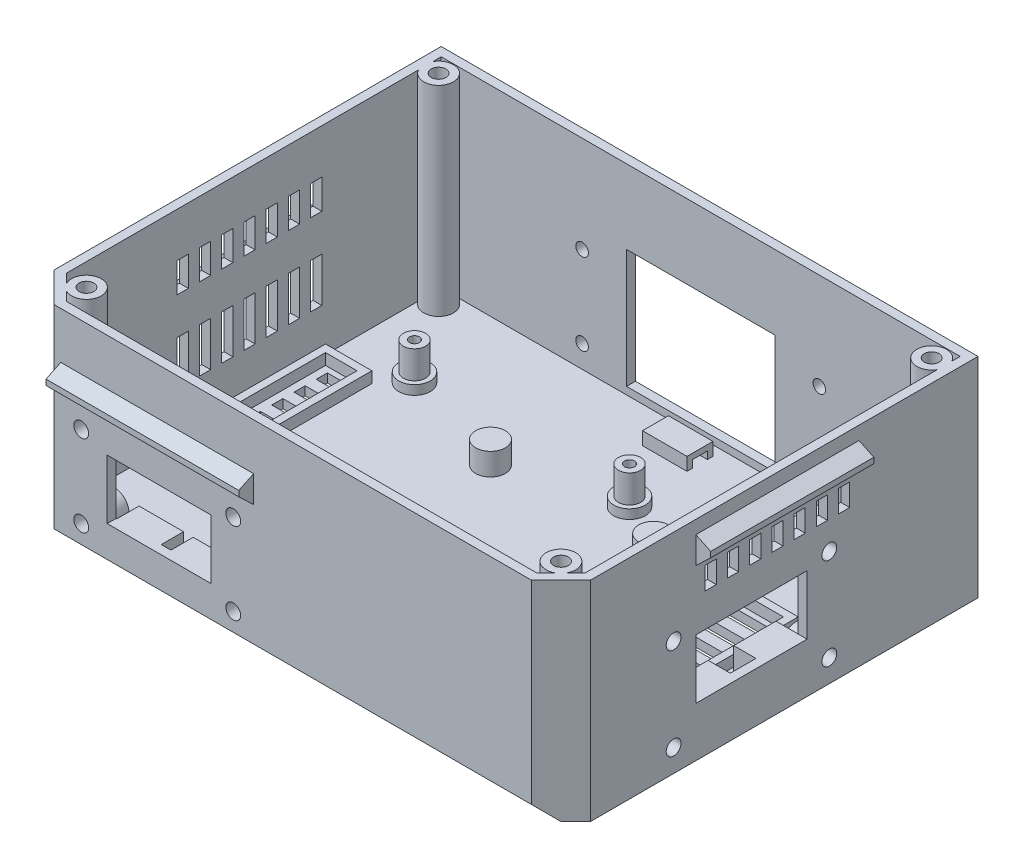
from build123d import *

# Parameters (mm, degrees)
BOX_BLOCK_DEPTH                     = 56.4
REAR_BOTTOM_FACET_DEPTH             = 147.709508894
REAR_BOTTOM_FACET_DEPTH_BACK        = 147.709508894
SHELL_T                             = -2.4
SKETCH3_R                           = 1.7
SKETCH3_W                           = 40
SKETCH3_H                           = 32
CABLE_WINDOW_AND_FLANGE_HOLES_DEPTH = 3.4
SKETCH4_R                           = 3
PI_STANDOFFS_DEPTH                  = 10.5
SKETCH5_R                           = 4.25
PI_STANDOFF_BASES_DEPTH             = 3
SKETCH6_R                           = 1.35
PI_SCREW_HOLES_DEPTH                = 13.4
SKETCH7_R                           = 2.75
PI_COUNTERBORES_DEPTH               = 2.7
SKETCH8_R                           = 4
LID_BOSS_1_DEPTH                    = 54.5
SKETCH9_R                           = 4
LID_BOSS_2_DEPTH                    = 54.5
SKETCH10_R                          = 4
LID_BOSS_3_DEPTH                    = 54.5
SKETCH11_R                          = 4
LID_BOSS_4_DEPTH                    = 54.5
SKETCH12_R                          = 2
LID_INSERT_HOLES_DEPTH              = 6.5
SKETCH13_W                          = 20
SKETCH13_H                          = 40
SKETCH13_W_2                        = 16
SKETCH13_H_2                        = 36
INTAKE_UPSTAND_DEPTH                = 3.5
SKETCH14_W                          = 12
SKETCH14_H                          = 3
INTAKE_SLOTS_DEPTH                  = 3.9
SKETCH15_W                          = 12.5
SKETCH15_H                          = 40
SKETCH15_W_2                        = 8.5
SKETCH15_H_2                        = 36
FLOOR_EXHAUST_UPSTAND_DEPTH         = 3.5
SKETCH16_W                          = 4.5
SKETCH16_H                          = 3
FLOOR_EXHAUST_SLOTS_DEPTH           = 3.9
SKETCH17_W                          = 3
SKETCH17_H                          = 12
EXHAUST_VENTS_DEPTH                 = 3.4
EXHAUST_DRIP_LEDGE_DEPTH            = 44
SKETCH19_W                          = 3
SKETCH19_H                          = 8
UPPER_VENTS_L_DEPTH                 = 3.4
UPPER_DRIP_LEDGE_L_DEPTH            = 44
SKETCH21_W                          = 3
SKETCH21_H                          = 6
UPPER_VENTS_R_DEPTH                 = 3.4
UPPER_DRIP_LEDGE_R_DEPTH            = 44
SKETCH23_W                          = 28
SKETCH23_H                          = 16
REAR_PORT_OPENING_DEPTH             = 3.4
SKETCH24_R                          = 4
REAR_PORT_BOSSES_DEPTH              = 6.6
SKETCH25_W                          = 8
SKETCH25_H                          = 7
REAR_PORT_BOSS_ROOTS_DEPTH          = 6.6
SKETCH26_R                          = 2
REAR_PORT_INSERT_HOLES_DEPTH        = 7
REAR_PORT_DRIP_LEDGE_DEPTH          = 52
SKETCH28_W                          = 12
SKETCH28_H                          = 6.1
REAR_TIE_BLOCK_USBC_DEPTH           = 10.5
SKETCH29_W                          = 3
SKETCH29_H                          = 2
REAR_TIE_TUNNEL_USBC_DEPTH          = 14
SKETCH30_W                          = 12
SKETCH30_H                          = 6.1
REAR_TIE_BLOCK_HDMI_DEPTH           = 10.5
SKETCH31_W                          = 3
SKETCH31_H                          = 2
REAR_TIE_TUNNEL_HDMI_DEPTH          = 14
SKETCH32_W                          = 30
SKETCH32_H                          = 16
SIDE_PORT_OPENING_DEPTH             = 3.4
SKETCH33_R                          = 4
SIDE_PORT_BOSSES_DEPTH              = 6.6
SKETCH34_R                          = 2
SIDE_PORT_INSERT_HOLES_DEPTH        = 7
SKETCH35_W                          = 6.1
SKETCH35_H                          = 11.7
SIDE_TIE_BLOCK_ETH_DEPTH            = 11.5
SKETCH36_W                          = 3
SKETCH36_H                          = 2
SIDE_TIE_TUNNEL_ETH_DEPTH           = 14
SKETCH37_W                          = 6.1
SKETCH37_H                          = 11.4
SIDE_TIE_BLOCK_USBA_DEPTH           = 11.5
SKETCH38_W                          = 3
SKETCH38_H                          = 2
SIDE_TIE_TUNNEL_USBA_DEPTH          = 14
SKETCH39_W                          = 12
SKETCH39_H                          = 7
BUNDLE_TIE_ANCHOR_DEPTH             = 4
SKETCH40_W                          = 4
SKETCH40_H                          = 2
BUNDLE_TIE_SLOT_DEPTH               = 14
SKETCH41_R                          = 4
RAIL_PLATE_BOSSES_DEPTH             = 6.5
SKETCH42_R                          = 2
RAIL_INSERT_HOLES_DEPTH             = 6.5


with BuildPart() as part:
    # Sketch1 → Box Block (new body)
    with BuildSketch(Plane(origin=(0, -28.4, 0), x_dir=(1, 0, 0), z_dir=(0, 1, 0))):
        Polygon((-64.4, -124.4), (64.4, -124.4), (72.4, -116.4), (72.4, -11.9), (-72.4, -11.9), (-72.4, -116.4), align=None)
    extrude(amount=BOX_BLOCK_DEPTH)

    # Sketch2 → Rear Bottom Facet (cut, two sides: drawn at the far end of the back side and taken through both)
    with BuildSketch(Plane(origin=(0, 0, 0), x_dir=(0, 0, -1), z_dir=(1, 0, 0)).offset(-REAR_BOTTOM_FACET_DEPTH_BACK)):
        Polygon((-125.4, -23.4), (-119.4, -29.4), (-125.4, -29.4), align=None)
    extrude(amount=REAR_BOTTOM_FACET_DEPTH + REAR_BOTTOM_FACET_DEPTH_BACK, mode=Mode.SUBTRACT)

    # Shell
    shell_openings = [part.faces().sort_by_distance(p)[0] for p in [
        (0, 28, 67.938651958),
    ]]
    offset(amount=SHELL_T, openings=shell_openings, kind=Kind.INTERSECTION)

    # Sketch3 → Cable Window and Flange Holes (cut)
    with BuildSketch(Plane.XY.offset(11.4)):
        with Locations((-32, 2)):
            Circle(SKETCH3_R)
        with Locations((32, 2)):
            Circle(SKETCH3_R)
        with Locations((-32, -20)):
            Circle(SKETCH3_R)
        with Locations((32, -20)):
            Circle(SKETCH3_R)
        with Locations((0, -8)):
            Rectangle(SKETCH3_W, SKETCH3_H)
    extrude(amount=CABLE_WINDOW_AND_FLANGE_HOLES_DEPTH, mode=Mode.SUBTRACT)

    # Sketch4 → Pi Standoffs (add)
    with BuildSketch(Plane(origin=(0, -26.5, 0), x_dir=(1, 0, 0), z_dir=(0, 1, 0))):
        with Locations((-51.5, -89)):
            Circle(SKETCH4_R)
        with Locations((6.5, -89)):
            Circle(SKETCH4_R)
        with Locations((-51.5, -40)):
            Circle(SKETCH4_R)
        with Locations((6.5, -40)):
            Circle(SKETCH4_R)
    extrude(amount=PI_STANDOFFS_DEPTH)

    # Sketch5 → Pi Standoff Bases (add)
    with BuildSketch(Plane(origin=(0, -26.5, 0), x_dir=(1, 0, 0), z_dir=(0, 1, 0))):
        with Locations((-51.5, -89)):
            Circle(SKETCH5_R)
        with Locations((6.5, -89)):
            Circle(SKETCH5_R)
        with Locations((-51.5, -40)):
            Circle(SKETCH5_R)
        with Locations((6.5, -40)):
            Circle(SKETCH5_R)
    extrude(amount=PI_STANDOFF_BASES_DEPTH)

    # Sketch6 → Pi Screw Holes (cut)
    with BuildSketch(Plane(origin=(0, -28.9, 0), x_dir=(1, 0, 0), z_dir=(0, 1, 0))):
        with Locations((-51.5, -89)):
            Circle(SKETCH6_R)
        with Locations((6.5, -89)):
            Circle(SKETCH6_R)
        with Locations((-51.5, -40)):
            Circle(SKETCH6_R)
        with Locations((6.5, -40)):
            Circle(SKETCH6_R)
    extrude(amount=PI_SCREW_HOLES_DEPTH, mode=Mode.SUBTRACT)

    # Sketch7 → Pi Counterbores (cut)
    with BuildSketch(Plane(origin=(0, -28.9, 0), x_dir=(1, 0, 0), z_dir=(0, 1, 0))):
        with Locations((-51.5, -89)):
            Circle(SKETCH7_R)
        with Locations((6.5, -89)):
            Circle(SKETCH7_R)
        with Locations((-51.5, -40)):
            Circle(SKETCH7_R)
        with Locations((6.5, -40)):
            Circle(SKETCH7_R)
    extrude(amount=PI_COUNTERBORES_DEPTH, mode=Mode.SUBTRACT)

    # Sketch8 → Lid Boss 1 (add)
    with BuildSketch(Plane(origin=(0, -26.5, 0), x_dir=(1, 0, 0), z_dir=(0, 1, 0))):
        with Locations((-66.5, -18.5)):
            Circle(SKETCH8_R)
    extrude(amount=LID_BOSS_1_DEPTH)

    # Sketch9 → Lid Boss 2 (add)
    with BuildSketch(Plane(origin=(0, -26.5, 0), x_dir=(1, 0, 0), z_dir=(0, 1, 0))):
        with Locations((66.5, -18.5)):
            Circle(SKETCH9_R)
    extrude(amount=LID_BOSS_2_DEPTH)

    # Sketch10 → Lid Boss 3 (add)
    with BuildSketch(Plane(origin=(0, -26.5, 0), x_dir=(1, 0, 0), z_dir=(0, 1, 0))):
        with Locations((-64, -116)):
            Circle(SKETCH10_R)
    extrude(amount=LID_BOSS_3_DEPTH)

    # Sketch11 → Lid Boss 4 (add)
    with BuildSketch(Plane(origin=(0, -26.5, 0), x_dir=(1, 0, 0), z_dir=(0, 1, 0))):
        with Locations((64, -116)):
            Circle(SKETCH11_R)
    extrude(amount=LID_BOSS_4_DEPTH)

    # Sketch12 → Lid Insert Holes (cut)
    with BuildSketch(Plane(origin=(0, 22, 0), x_dir=(1, 0, 0), z_dir=(0, 1, 0))):
        with Locations((-66.5, -18.5)):
            Circle(SKETCH12_R)
        with Locations((66.5, -18.5)):
            Circle(SKETCH12_R)
        with Locations((-64, -116)):
            Circle(SKETCH12_R)
        with Locations((64, -116)):
            Circle(SKETCH12_R)
    extrude(amount=LID_INSERT_HOLES_DEPTH, mode=Mode.SUBTRACT)

    # Sketch13 → Intake Upstand (add)
    with BuildSketch(Plane(origin=(0, -26.5, 0), x_dir=(1, 0, 0), z_dir=(0, 1, 0))):
        with Locations((48, -66)):
            Rectangle(SKETCH13_W, SKETCH13_H)
        with Locations((48, -66)):
            Rectangle(SKETCH13_W_2, SKETCH13_H_2, mode=Mode.SUBTRACT)
    extrude(amount=INTAKE_UPSTAND_DEPTH)

    # Sketch14 → Intake Slots (cut)
    with BuildSketch(Plane(origin=(0, -29.4, 0), x_dir=(1, 0, 0), z_dir=(0, 1, 0))):
        with Locations((48, -81)):
            Rectangle(SKETCH14_W, SKETCH14_H)
        with Locations((48, -75)):
            Rectangle(SKETCH14_W, SKETCH14_H)
        with Locations((48, -69)):
            Rectangle(SKETCH14_W, SKETCH14_H)
        with Locations((48, -63)):
            Rectangle(SKETCH14_W, SKETCH14_H)
        with Locations((48, -57)):
            Rectangle(SKETCH14_W, SKETCH14_H)
        with Locations((48, -51)):
            Rectangle(SKETCH14_W, SKETCH14_H)
    extrude(amount=INTAKE_SLOTS_DEPTH, mode=Mode.SUBTRACT)

    # Sketch15 → Floor Exhaust Upstand (add)
    with BuildSketch(Plane(origin=(0, -26.5, 0), x_dir=(1, 0, 0), z_dir=(0, 1, 0))):
        with Locations((-63.25, -66)):
            Rectangle(SKETCH15_W, SKETCH15_H)
        with Locations((-63.25, -66)):
            Rectangle(SKETCH15_W_2, SKETCH15_H_2, mode=Mode.SUBTRACT)
    extrude(amount=FLOOR_EXHAUST_UPSTAND_DEPTH)

    # Sketch16 → Floor Exhaust Slots (cut)
    with BuildSketch(Plane(origin=(0, -29.4, 0), x_dir=(1, 0, 0), z_dir=(0, 1, 0))):
        with Locations((-63.25, -81)):
            Rectangle(SKETCH16_W, SKETCH16_H)
        with Locations((-63.25, -75)):
            Rectangle(SKETCH16_W, SKETCH16_H)
        with Locations((-63.25, -69)):
            Rectangle(SKETCH16_W, SKETCH16_H)
        with Locations((-63.25, -63)):
            Rectangle(SKETCH16_W, SKETCH16_H)
        with Locations((-63.25, -57)):
            Rectangle(SKETCH16_W, SKETCH16_H)
        with Locations((-63.25, -51)):
            Rectangle(SKETCH16_W, SKETCH16_H)
    extrude(amount=FLOOR_EXHAUST_SLOTS_DEPTH, mode=Mode.SUBTRACT)

    # Sketch17 → Exhaust Vents (cut)
    with BuildSketch(Plane(origin=(-72.9, 0, 0), x_dir=(0, 0, -1), z_dir=(1, 0, 0))):
        with Locations((-84, -8)):
            Rectangle(SKETCH17_W, SKETCH17_H)
        with Locations((-78, -8)):
            Rectangle(SKETCH17_W, SKETCH17_H)
        with Locations((-72, -8)):
            Rectangle(SKETCH17_W, SKETCH17_H)
        with Locations((-66, -8)):
            Rectangle(SKETCH17_W, SKETCH17_H)
        with Locations((-60, -8)):
            Rectangle(SKETCH17_W, SKETCH17_H)
        with Locations((-54, -8)):
            Rectangle(SKETCH17_W, SKETCH17_H)
        with Locations((-48, -8)):
            Rectangle(SKETCH17_W, SKETCH17_H)
    extrude(amount=EXHAUST_VENTS_DEPTH, mode=Mode.SUBTRACT)

    # Sketch18 → Exhaust Drip Ledge (add)
    with BuildSketch(Plane.XY.offset(44)):
        Polygon((-72.2, -0.5), (-76.4, 3.5), (-76.4, 5), (-72.2, 7), align=None)
    extrude(amount=EXHAUST_DRIP_LEDGE_DEPTH)

    # Sketch19 → Upper Vents L (cut)
    with BuildSketch(Plane(origin=(-72.9, 0, 0), x_dir=(0, 0, -1), z_dir=(1, 0, 0))):
        with Locations((-84, 12)):
            Rectangle(SKETCH19_W, SKETCH19_H)
        with Locations((-78, 12)):
            Rectangle(SKETCH19_W, SKETCH19_H)
        with Locations((-72, 12)):
            Rectangle(SKETCH19_W, SKETCH19_H)
        with Locations((-66, 12)):
            Rectangle(SKETCH19_W, SKETCH19_H)
        with Locations((-60, 12)):
            Rectangle(SKETCH19_W, SKETCH19_H)
        with Locations((-54, 12)):
            Rectangle(SKETCH19_W, SKETCH19_H)
        with Locations((-48, 12)):
            Rectangle(SKETCH19_W, SKETCH19_H)
    extrude(amount=UPPER_VENTS_L_DEPTH, mode=Mode.SUBTRACT)

    # Sketch20 → Upper Drip Ledge L (add)
    with BuildSketch(Plane.XY.offset(44)):
        Polygon((-72.2, 17), (-76.4, 21), (-76.4, 22.5), (-72.2, 24.5), align=None)
    extrude(amount=UPPER_DRIP_LEDGE_L_DEPTH)

    # Sketch21 → Upper Vents R (cut)
    with BuildSketch(Plane(origin=(69.5, 0, 0), x_dir=(0, 0, -1), z_dir=(1, 0, 0))):
        with Locations((-84, 13)):
            Rectangle(SKETCH21_W, SKETCH21_H)
        with Locations((-78, 13)):
            Rectangle(SKETCH21_W, SKETCH21_H)
        with Locations((-72, 13)):
            Rectangle(SKETCH21_W, SKETCH21_H)
        with Locations((-66, 13)):
            Rectangle(SKETCH21_W, SKETCH21_H)
        with Locations((-60, 13)):
            Rectangle(SKETCH21_W, SKETCH21_H)
        with Locations((-54, 13)):
            Rectangle(SKETCH21_W, SKETCH21_H)
        with Locations((-48, 13)):
            Rectangle(SKETCH21_W, SKETCH21_H)
    extrude(amount=UPPER_VENTS_R_DEPTH, mode=Mode.SUBTRACT)

    # Sketch22 → Upper Drip Ledge R (add)
    with BuildSketch(Plane.XY.offset(44)):
        Polygon((72.2, 17), (76.4, 21), (76.4, 22.5), (72.2, 24.5), align=None)
    extrude(amount=UPPER_DRIP_LEDGE_R_DEPTH)

    # Sketch23 → Rear Port Opening (cut)
    with BuildSketch(Plane.XY.offset(121.5)):
        with Locations((-36, -8)):
            Rectangle(SKETCH23_W, SKETCH23_H)
    extrude(amount=REAR_PORT_OPENING_DEPTH, mode=Mode.SUBTRACT)

    # Sketch24 → Rear Port Bosses (add)
    with BuildSketch(Plane.XY.offset(115.5)):
        with Locations((-57, -19.5)):
            Circle(SKETCH24_R)
        with Locations((-57, 2.5)):
            Circle(SKETCH24_R)
        with Locations((-16, -19.5)):
            Circle(SKETCH24_R)
        with Locations((-16, 2.5)):
            Circle(SKETCH24_R)
    extrude(amount=REAR_PORT_BOSSES_DEPTH)

    # Sketch25 → Rear Port Boss Roots (add)
    with BuildSketch(Plane.XY.offset(115.5)):
        with Locations((-57, -23)):
            Rectangle(SKETCH25_W, SKETCH25_H)
        with Locations((-16, -23)):
            Rectangle(SKETCH25_W, SKETCH25_H)
    extrude(amount=REAR_PORT_BOSS_ROOTS_DEPTH)

    # Sketch26 → Rear Port Insert Holes (cut)
    with BuildSketch(Plane.XY.offset(117.9)):
        with Locations((-57, -19.5)):
            Circle(SKETCH26_R)
        with Locations((-57, 2.5)):
            Circle(SKETCH26_R)
        with Locations((-16, -19.5)):
            Circle(SKETCH26_R)
        with Locations((-16, 2.5)):
            Circle(SKETCH26_R)
    extrude(amount=REAR_PORT_INSERT_HOLES_DEPTH, mode=Mode.SUBTRACT)

    # Sketch27 → Rear Port Drip Ledge (add)
    with BuildSketch(Plane(origin=(-62.5, 0, 0), x_dir=(0, 0, -1), z_dir=(1, 0, 0))):
        Polygon((-124.2, 8), (-128.4, 12), (-128.4, 13.5), (-124.2, 15.5), align=None)
    extrude(amount=REAR_PORT_DRIP_LEDGE_DEPTH)

    # Sketch28 → Rear Tie Block usbc (add)
    with BuildSketch(Plane(origin=(0, -26.5, 0), x_dir=(1, 0, 0), z_dir=(0, 1, 0))):
        with Locations((-43.8, -119.05)):
            Rectangle(SKETCH28_W, SKETCH28_H)
    extrude(amount=REAR_TIE_BLOCK_USBC_DEPTH)

    # Sketch29 → Rear Tie Tunnel usbc (cut)
    with BuildSketch(Plane(origin=(-50.8, 0, 0), x_dir=(0, 0, -1), z_dir=(1, 0, 0))):
        with Locations((-119, -23.5)):
            Rectangle(SKETCH29_W, SKETCH29_H)
    extrude(amount=REAR_TIE_TUNNEL_USBC_DEPTH, mode=Mode.SUBTRACT)

    # Sketch30 → Rear Tie Block hdmi (add)
    with BuildSketch(Plane(origin=(0, -26.5, 0), x_dir=(1, 0, 0), z_dir=(0, 1, 0))):
        with Locations((-29.2, -119.05)):
            Rectangle(SKETCH30_W, SKETCH30_H)
    extrude(amount=REAR_TIE_BLOCK_HDMI_DEPTH)

    # Sketch31 → Rear Tie Tunnel hdmi (cut)
    with BuildSketch(Plane(origin=(-36.2, 0, 0), x_dir=(0, 0, -1), z_dir=(1, 0, 0))):
        with Locations((-119, -23.5)):
            Rectangle(SKETCH31_W, SKETCH31_H)
    extrude(amount=REAR_TIE_TUNNEL_HDMI_DEPTH, mode=Mode.SUBTRACT)

    # Sketch32 → Side Port Opening (cut)
    with BuildSketch(Plane(origin=(69.5, 0, 0), x_dir=(0, 0, -1), z_dir=(1, 0, 0))):
        with Locations((-73, -7)):
            Rectangle(SKETCH32_W, SKETCH32_H)
    extrude(amount=SIDE_PORT_OPENING_DEPTH, mode=Mode.SUBTRACT)

    # Sketch33 → Side Port Bosses (add)
    with BuildSketch(Plane(origin=(63.5, 0, 0), x_dir=(0, 0, -1), z_dir=(1, 0, 0))):
        with Locations((-94, -22.3)):
            Circle(SKETCH33_R)
        with Locations((-94, 2.5)):
            Circle(SKETCH33_R)
        with Locations((-52, -22.3)):
            Circle(SKETCH33_R)
        with Locations((-52, 2.5)):
            Circle(SKETCH33_R)
    extrude(amount=SIDE_PORT_BOSSES_DEPTH)

    # Sketch34 → Side Port Insert Holes (cut)
    with BuildSketch(Plane(origin=(65.9, 0, 0), x_dir=(0, 0, -1), z_dir=(1, 0, 0))):
        with Locations((-94, -22.3)):
            Circle(SKETCH34_R)
        with Locations((-94, 2.5)):
            Circle(SKETCH34_R)
        with Locations((-52, -22.3)):
            Circle(SKETCH34_R)
        with Locations((-52, 2.5)):
            Circle(SKETCH34_R)
    extrude(amount=SIDE_PORT_INSERT_HOLES_DEPTH, mode=Mode.SUBTRACT)

    # Sketch35 → Side Tie Block eth (add)
    with BuildSketch(Plane(origin=(0, -26.5, 0), x_dir=(1, 0, 0), z_dir=(0, 1, 0))):
        with Locations((67.05, -82.15)):
            Rectangle(SKETCH35_W, SKETCH35_H)
    extrude(amount=SIDE_TIE_BLOCK_ETH_DEPTH)

    # Sketch36 → Side Tie Tunnel eth (cut)
    with BuildSketch(Plane.XY.offset(75.3)):
        with Locations((67, -23.5)):
            Rectangle(SKETCH36_W, SKETCH36_H)
    extrude(amount=SIDE_TIE_TUNNEL_ETH_DEPTH, mode=Mode.SUBTRACT)

    # Sketch37 → Side Tie Block usba (add)
    with BuildSketch(Plane(origin=(0, -26.5, 0), x_dir=(1, 0, 0), z_dir=(0, 1, 0))):
        with Locations((67.05, -63.7)):
            Rectangle(SKETCH37_W, SKETCH37_H)
    extrude(amount=SIDE_TIE_BLOCK_USBA_DEPTH)

    # Sketch38 → Side Tie Tunnel usba (cut)
    with BuildSketch(Plane.XY.offset(56.4)):
        with Locations((67, -23.5)):
            Rectangle(SKETCH38_W, SKETCH38_H)
    extrude(amount=SIDE_TIE_TUNNEL_USBA_DEPTH, mode=Mode.SUBTRACT)

    # Sketch39 → Bundle Tie Anchor (add)
    with BuildSketch(Plane(origin=(0, -26.5, 0), x_dir=(1, 0, 0), z_dir=(0, 1, 0))):
        with Locations((0, -20.5)):
            Rectangle(SKETCH39_W, SKETCH39_H)
    extrude(amount=BUNDLE_TIE_ANCHOR_DEPTH)

    # Sketch40 → Bundle Tie Slot (cut)
    with BuildSketch(Plane(origin=(-7, 0, 0), x_dir=(0, 0, -1), z_dir=(1, 0, 0))):
        with Locations((-20.5, -25)):
            Rectangle(SKETCH40_W, SKETCH40_H)
    extrude(amount=BUNDLE_TIE_SLOT_DEPTH, mode=Mode.SUBTRACT)

    # Sketch41 → Rail Plate Bosses (add)
    with BuildSketch(Plane(origin=(0, -26.5, 0), x_dir=(1, 0, 0), z_dir=(0, 1, 0))):
        with Locations((-22, -91)):
            Circle(SKETCH41_R)
        with Locations((-22, -49)):
            Circle(SKETCH41_R)
        with Locations((22, -91)):
            Circle(SKETCH41_R)
        with Locations((22, -49)):
            Circle(SKETCH41_R)
    extrude(amount=RAIL_PLATE_BOSSES_DEPTH)

    # Sketch42 → Rail Insert Holes (cut)
    with BuildSketch(Plane(origin=(0, -28.9, 0), x_dir=(1, 0, 0), z_dir=(0, 1, 0))):
        with Locations((-22, -91)):
            Circle(SKETCH42_R)
        with Locations((-22, -49)):
            Circle(SKETCH42_R)
        with Locations((22, -91)):
            Circle(SKETCH42_R)
        with Locations((22, -49)):
            Circle(SKETCH42_R)
    extrude(amount=RAIL_INSERT_HOLES_DEPTH, mode=Mode.SUBTRACT)


solid = part.part
